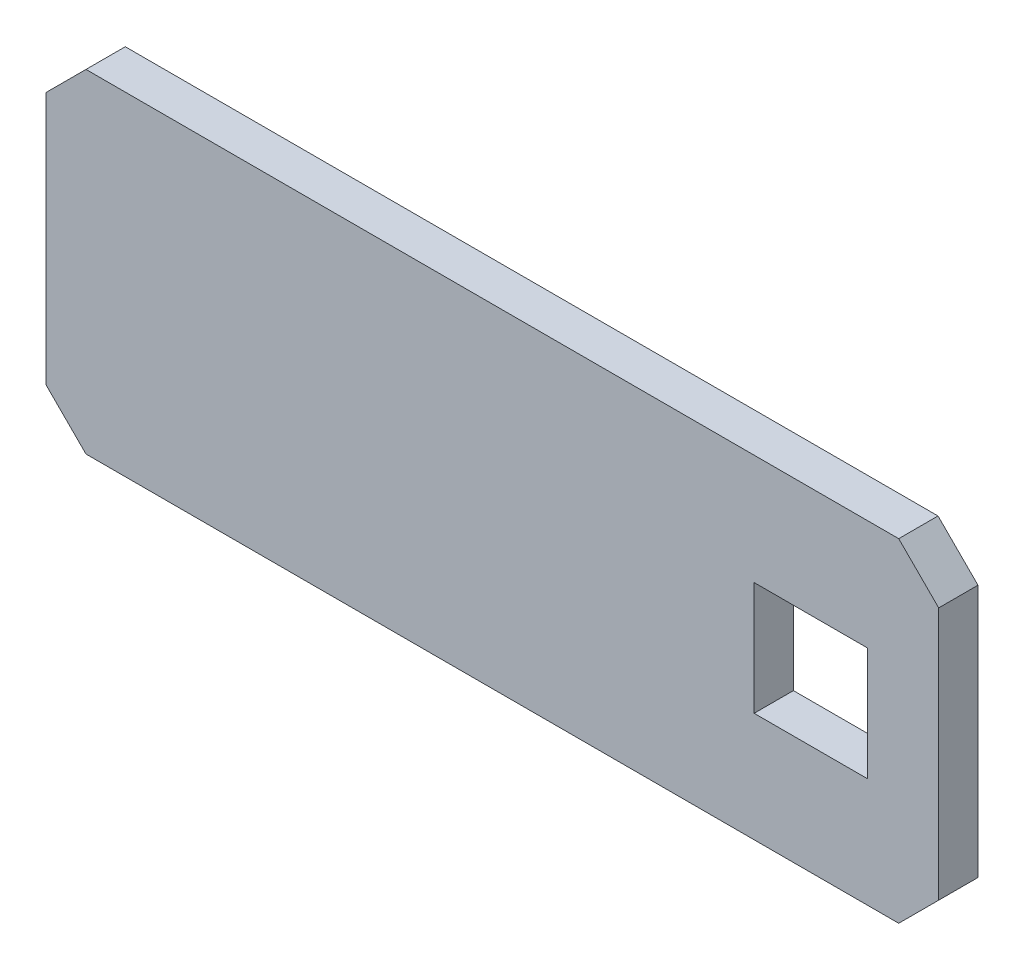
from build123d import *

# Parameters (mm, degrees)
SKETCH_1_W             = 84
SKETCH_1_H             = 55
SM_BASE_FLANGE_1_DEPTH = 2.95
SKETCH_5_W             = 8.5
SKETCH_5_H             = 8.5
CUT_EXTRUDE_1_DEPTH    = 10
CHAMFER_1_SIZE         = 3


# Sheet-metal steps are written as plain solids
with BuildPart() as part:
    # Sketch 1 → Базовая кромка1 (new body)
    with BuildSketch(Plane.XY):
        with Locations((-22.345696863, 3.516131621)):
            Rectangle(SKETCH_1_W, SKETCH_1_H)
    extrude(amount=-SM_BASE_FLANGE_1_DEPTH)

    # Эскиз5 → Вырез-Вытянуть1 (cut)
    with BuildSketch(Plane(origin=(0, 0, -2.95), x_dir=(-1, 0, 0), z_dir=(0, 0, -1))):
        Polygon((64.345696863, -23.983868379), (64.345696863, -8.483868379), (-2.654303137, -8.483868379), (-2.654303137, 16.516131621), (64.345696863, 16.516131621), (64.345696863, 31.016131621), (-19.654303137, 31.016131621), (-19.654303137, -23.983868379), align=None)
        with Locations((6.948166656, 3.987990807)):
            Rectangle(SKETCH_5_W, SKETCH_5_H)
    extrude(amount=-CUT_EXTRUDE_1_DEPTH, mode=Mode.SUBTRACT)

    # Фаска1
    chamfer_1_edges = [part.edges().sort_by_distance(p)[0] for p in [
        (2.654303137, 16.516131621, -1.475),
        (2.654303137, -8.483868379, -1.475),
        (-64.345696863, -8.483868379, -1.475),
        (-64.345696863, 16.516131621, -1.475),
    ]]
    chamfer(chamfer_1_edges, length=CHAMFER_1_SIZE)


solid = part.part
